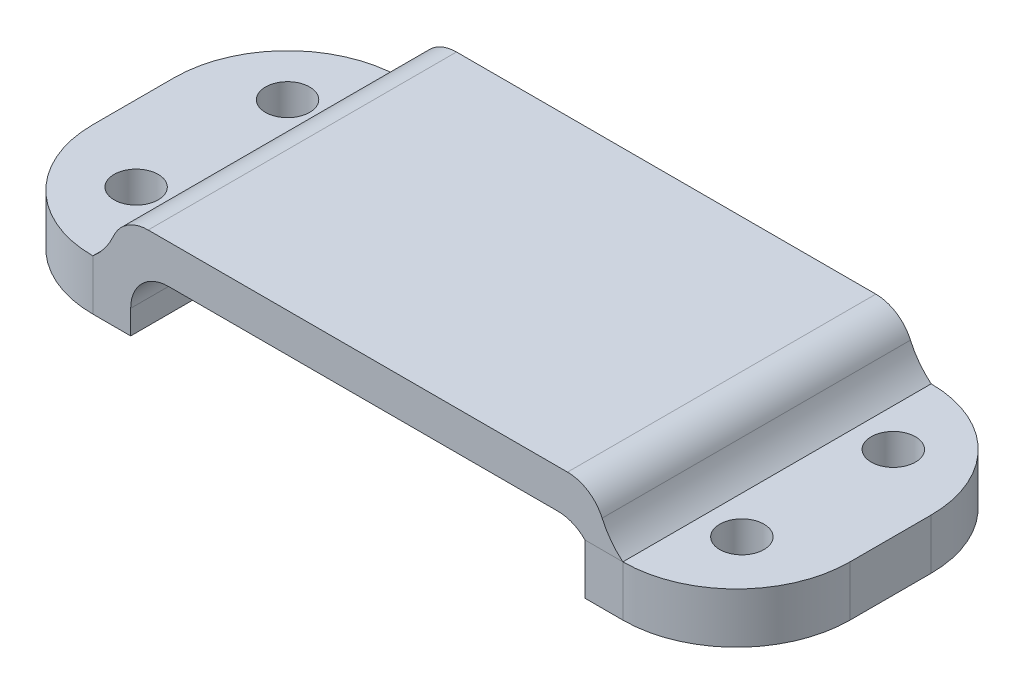
from build123d import *

# Parameters (mm, degrees)
SKETCH2_W                       = 12
SKETCH2_H                       = 24.43
BOSS_EXTRUDE1_DEPTH             = 4
BOSS_EXTRUDE1_2_DEPTH           = 4
SKETCH3_R                       = 1.75
CUT_EXTRUDE1_DEPTH              = 4
FILLET1_R                       = 9
FILLET2_R                       = 9
BOSS_EXTRUDE2_REACH             = 34.637
SKETCH4_W                       = 18
SKETCH4_H                       = 3.065440856
SKETCH4_W_2                     = 1.61467478
BOSS_EXTRUDE2_DIRECTION_2_REACH = 34.637
FILLET3_R                       = 3
FILLET4_R                       = 6


with BuildPart() as part:
    # Sketch2 → Boss-Extrude1 (new body)
    with BuildSketch(Plane(origin=(0, 0, 0), x_dir=(1, 0, 0), z_dir=(0, 1, 0))):
        with Locations((-24, 0)):
            Rectangle(SKETCH2_W, SKETCH2_H)
    extrude(amount=BOSS_EXTRUDE1_DEPTH)


with BuildPart() as body_2:
    # Sketch2 → Boss-Extrude1 2 (new body)
    with BuildSketch(Plane(origin=(0, 0, 0), x_dir=(1, 0, 0), z_dir=(0, 1, 0))):
        with Locations((24, 0)):
            Rectangle(SKETCH2_W, SKETCH2_H)
    extrude(amount=BOSS_EXTRUDE1_2_DEPTH)


with BuildPart() as cut_extrude1_tool:
    # Sketch3 → Cut-Extrude1 (new body)
    with BuildSketch(Plane(origin=(0, 4, 0), x_dir=(1, 0, 0), z_dir=(0, 1, 0))):
        with Locations(Location((-24, 6.215, 0), (0, 0, 270))):
            Circle(SKETCH3_R)
        with Locations(Location((24, 6.215, 0), (0, 0, 270))):
            Circle(SKETCH3_R)
        with Locations(Location((24, -5.785, 0), (0, 0, 270))):
            Circle(SKETCH3_R)
        with Locations(Location((-24, -5.785, 0), (0, 0, 270))):
            Circle(SKETCH3_R)
    extrude(amount=-CUT_EXTRUDE1_DEPTH)


with BuildPart() as part_1:
    add(part.part)

    # Cut-Extrude1: cut by cut_extrude1_tool
    add(cut_extrude1_tool.part, mode=Mode.SUBTRACT)

    # Fillet1
    fillet1_edges = [part_1.edges().sort_by_distance(p)[0] for p in [
        (-30, 2, 12.215),
        (-30, 2, -12.215),
    ]]
    fillet(fillet1_edges, radius=FILLET1_R)

    # Boss-Extrude2: up to this face of the body (flat: up to its plane)
    boss_extrude2_end = Plane(part_1.part.faces().sort_by_distance((-19.5, 2, 12.215))[0])
    # Sketch4 → Boss-Extrude2 (add, up to the picked face)
    with BuildSketch(Plane.XY, mode=Mode.PRIVATE) as boss_extrude2_sk1:
        with Locations((-9, 6.432720428)):
            Rectangle(SKETCH4_W, SKETCH4_H)
    boss_extrude2_tool1 = split(extrude(boss_extrude2_sk1.sketch, amount=BOSS_EXTRUDE2_REACH, mode=Mode.PRIVATE), bisect_by=boss_extrude2_end, keep=Keep.BOTH, mode=Mode.PRIVATE)
    # Sketch4 → Boss-Extrude2 (add, up to the picked face)
    with BuildSketch(Plane.XY, mode=Mode.PRIVATE) as boss_extrude2_sk2:
        with Locations((-18.80733739, 6.432720428)):
            Rectangle(SKETCH4_W_2, SKETCH4_H)
    boss_extrude2_tool2 = split(extrude(boss_extrude2_sk2.sketch, amount=BOSS_EXTRUDE2_REACH, mode=Mode.PRIVATE), bisect_by=boss_extrude2_end, keep=Keep.BOTH, mode=Mode.PRIVATE)
    # Sketch4 → Boss-Extrude2 (add, up to the picked face)
    with BuildSketch(Plane.XY, mode=Mode.PRIVATE) as boss_extrude2_sk3:
        Polygon((-18, 4), (-18, 4.9), (-19.61467478, 4.9), (-21, 4), align=None)
    boss_extrude2_tool3 = split(extrude(boss_extrude2_sk3.sketch, amount=BOSS_EXTRUDE2_REACH, mode=Mode.PRIVATE), bisect_by=boss_extrude2_end, keep=Keep.BOTH, mode=Mode.PRIVATE)
    boss_extrude2_1 = boss_extrude2_tool1.solids().sort_by(Axis((-9, 6.43272, 0), (0, 0, 1)))[0]
    add(boss_extrude2_1)
    boss_extrude2_2 = boss_extrude2_tool2.solids().sort_by(Axis((-18.807337, 6.43272, 0), (0, 0, 1)))[0]
    add(boss_extrude2_2)
    boss_extrude2_3 = boss_extrude2_tool3.solids().sort_by(Axis((-19.188325, 4.40497, 0), (0, 0, 1)))[0]
    add(boss_extrude2_3)
    boss_extrude2 = boss_extrude2_1 + boss_extrude2_2 + boss_extrude2_3  # Boss-Extrude2 as one shape, for the pattern or mirror that repeats it

    # Boss-Extrude2 direction 2: up to this face of the body (flat: up to its plane)
    boss_extrude2_direction_2_end = Plane(part_1.part.faces().sort_by_distance((-19.5, 2, -12.215))[0])
    # Sketch4 → Boss-Extrude2 direction 2 (add, up to the picked face)
    with BuildSketch(Plane.XY, mode=Mode.PRIVATE) as boss_extrude2_direction_2_sk1:
        with Locations((-9, 6.432720428)):
            Rectangle(SKETCH4_W, SKETCH4_H)
    boss_extrude2_direction_2_tool1 = split(extrude(boss_extrude2_direction_2_sk1.sketch, amount=-BOSS_EXTRUDE2_DIRECTION_2_REACH, mode=Mode.PRIVATE), bisect_by=boss_extrude2_direction_2_end, keep=Keep.BOTH, mode=Mode.PRIVATE)
    # Sketch4 → Boss-Extrude2 direction 2 (add, up to the picked face)
    with BuildSketch(Plane.XY, mode=Mode.PRIVATE) as boss_extrude2_direction_2_sk2:
        with Locations((-18.80733739, 6.432720428)):
            Rectangle(SKETCH4_W_2, SKETCH4_H)
    boss_extrude2_direction_2_tool2 = split(extrude(boss_extrude2_direction_2_sk2.sketch, amount=-BOSS_EXTRUDE2_DIRECTION_2_REACH, mode=Mode.PRIVATE), bisect_by=boss_extrude2_direction_2_end, keep=Keep.BOTH, mode=Mode.PRIVATE)
    # Sketch4 → Boss-Extrude2 direction 2 (add, up to the picked face)
    with BuildSketch(Plane.XY, mode=Mode.PRIVATE) as boss_extrude2_direction_2_sk3:
        Polygon((-18, 4), (-18, 4.9), (-19.61467478, 4.9), (-21, 4), align=None)
    boss_extrude2_direction_2_tool3 = split(extrude(boss_extrude2_direction_2_sk3.sketch, amount=-BOSS_EXTRUDE2_DIRECTION_2_REACH, mode=Mode.PRIVATE), bisect_by=boss_extrude2_direction_2_end, keep=Keep.BOTH, mode=Mode.PRIVATE)
    boss_extrude2_direction_2_1 = boss_extrude2_direction_2_tool1.solids().sort_by(Axis((-9, 6.43272, 0), (0, 0, -1)))[0]
    add(boss_extrude2_direction_2_1)
    boss_extrude2_direction_2_2 = boss_extrude2_direction_2_tool2.solids().sort_by(Axis((-18.807337, 6.43272, 0), (0, 0, -1)))[0]
    add(boss_extrude2_direction_2_2)
    boss_extrude2_direction_2_3 = boss_extrude2_direction_2_tool3.solids().sort_by(Axis((-19.188325, 4.40497, 0), (0, 0, -1)))[0]
    add(boss_extrude2_direction_2_3)
    boss_extrude2_direction_2 = boss_extrude2_direction_2_1 + boss_extrude2_direction_2_2 + boss_extrude2_direction_2_3  # Boss-Extrude2 direction 2 as one shape, for the pattern or mirror that repeats it

    # Mirror1: Boss-Extrude2, Boss-Extrude2 direction 2 across plane
    add(boss_extrude2.mirror(Plane(origin=(0, 0, 0), x_dir=(0, 0, 1), z_dir=(1, 0, 0))))
    add(boss_extrude2_direction_2.mirror(Plane(origin=(0, 0, 0), x_dir=(0, 0, 1), z_dir=(1, 0, 0))))

    # Fillet3
    # the kernel refuses this fillet: 3 mm, written as the material it adds along each edge
    with BuildSketch(Plane(origin=(18, 4.9, -12.215), x_dir=(-1, 0, 0), z_dir=(0, 0, 1))) as fillet3_piece_1:
        with BuildLine():
            CenterArc((2.142428529, 3), FILLET3_R, 224.427004001, 45.572995999)
            Line((0, 0.9), (0, 0))
            Line((0, 0), (2.142428529, 0))
        make_face()
    extrude(amount=24.43)
    with BuildSketch(Plane(origin=(-18, 4.9, -12.215), x_dir=(0, -1, 0), z_dir=(0, 0, 1))) as fillet3_piece_2:
        with BuildLine():
            CenterArc((FILLET3_R, FILLET3_R), FILLET3_R, 180, 90)
            Line((0, FILLET3_R), (0, 0))
            Line((0, 0), (FILLET3_R, 0))
        make_face()
    extrude(amount=24.43)
    # the kernel refuses this fillet: 3 mm, written as the material it takes off along each edge
    with BuildSketch(Plane(origin=(19.61467478, 7.965440856, 19.715), x_dir=(-1, 0, 0), z_dir=(0, 0, -1)), Plane(origin=(-19.61467478, 7.965440856, 19.715), x_dir=(0, -1, 0), z_dir=(0, 0, -1))) as fillet3_2_piece_1:
        with BuildLine():
            CenterArc((FILLET3_R, -FILLET3_R), FILLET3_R, 90, 90)
            Line((0, -FILLET3_R), (0, 0))
            Line((0, 0), (FILLET3_R, 0))
        make_face()
    extrude(amount=39.43, mode=Mode.SUBTRACT)

    # Fillet4
    # the kernel refuses this fillet: 6 mm, written as the material it adds along each edge
    with BuildSketch(Plane(origin=(19.61467478, 4.9, 12.215), x_dir=(0.8385712137363982, -0.5447919965387378, 0), z_dir=(0, 0, -1))) as fillet4_piece_1_section:
        with BuildLine():
            CenterArc((2.367890606, -5.957139428), FILLET4_R, 96.852512832, 26.280461669)
            Line((-0.911613329, -0.932713695), (-1.239563722, -0.430271121))
            ThreePointArc((-1.239563722, -0.430271121), (-0.538794383, 0.27199838), (-0.503142728, 0.326875198))
            Line((-0.503142728, 0.326875198), (0, 0.6))
            ThreePointArc((0, 0.6), (0.826003324, 0.6), (1.580418252, 0.595713943))
            Line((1.580418252, 0.595713943), (1.652006648, 0))
        make_face()
    fillet4_piece_1 = extrude(amount=24.43, mode=Mode.PRIVATE)
    fillet4_piece_1 = split(fillet4_piece_1, bisect_by=Plane(origin=(19.61467478, 4, 12.215), z_dir=(0, 1, 0)), keep=Keep.TOP, mode=Mode.PRIVATE)
    add(fillet4_piece_1)
    with BuildSketch(Plane(origin=(-19.61467478, 4.9, 12.215), x_dir=(0.19652930214172712, 0.9804979517570068, 0), z_dir=(0, 0, -1))) as fillet4_piece_2:
        with BuildLine():
            CenterArc((2.605159409, -5.857265619), FILLET4_R, 102.522499919, 26.280461669)
            Line((-1.154705155, -1.181432169), (-1.530691612, -0.713848824))
            ThreePointArc((-1.530691612, -0.713848824), (-1.006442438, -0.171333333), (-0.42908986, 0.419382751))
            Line((-0.42908986, 0.419382751), (0.117917581, 0.588298771))
            ThreePointArc((0.117917581, 0.588298771), (0.182082206, 0.575437725), (1.174127699, 0.585726562))
            Line((1.174127699, 0.585726562), (1.304221491, 0))
        make_face()
    extrude(amount=24.43)


with BuildPart() as body_2_1:
    add(body_2.part)

    # Cut-Extrude1: cut by cut_extrude1_tool
    add(cut_extrude1_tool.part, mode=Mode.SUBTRACT)

    # Fillet2
    fillet2_edges = [body_2_1.edges().sort_by_distance(p)[0] for p in [
        (30, 2, -12.215),
        (30, 2, 12.215),
    ]]
    fillet(fillet2_edges, radius=FILLET2_R)


solid = Compound([part_1.part, body_2_1.part])
